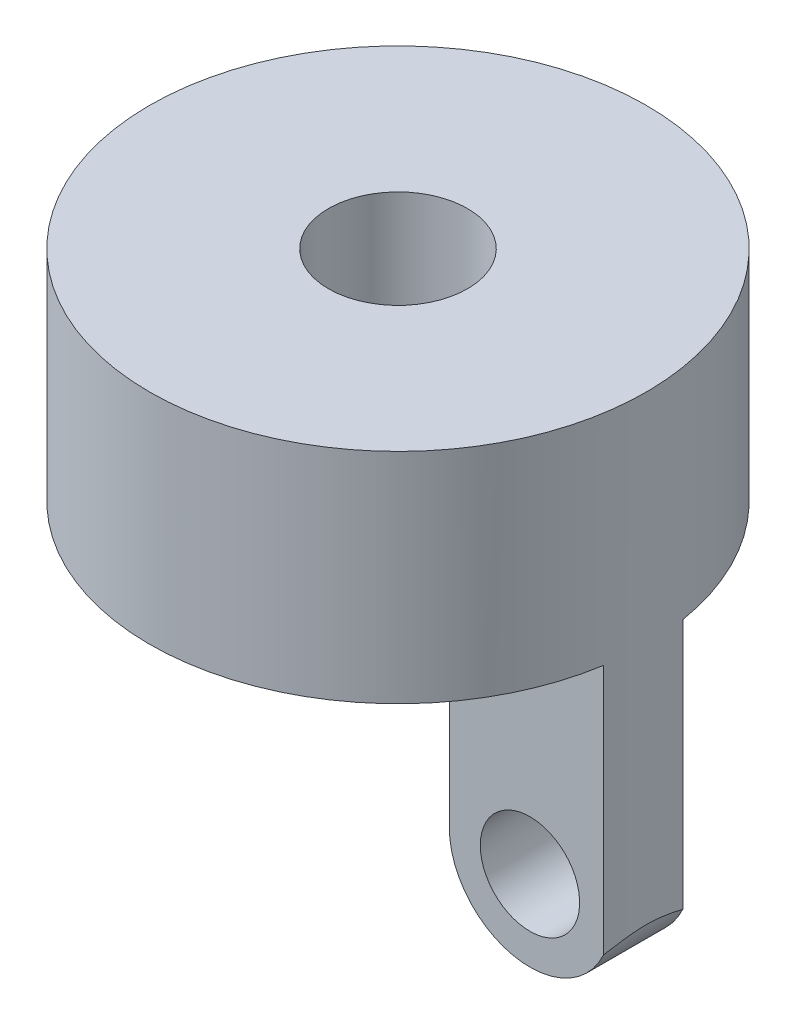
from build123d import *
from build123d.topology import SkipClean

# Parameters (mm, degrees)
SKETCH1_R                      = 12.5
SKETCH1_R_2                    = 3.5
BOSS_EXTRUDE1_DEPTH            = 5
BOSS_EXTRUDE2_START            = 6
SKETCH2_R                      = 12.5
SKETCH2_R_2                    = 5
BOSS_EXTRUDE2_DEPTH            = 6
SKETCH3_W                      = 10.120170627
SKETCH3_H                      = 4
BOSS_EXTRUDE3_DEPTH            = 15
SKETCH2_2_OUTSIDE_W            = 37.094
SKETCH2_2_OUTSIDE_H            = 35.914
SKETCH2_2_OUTSIDE_R            = 12.5
SKETCH2_2_OUTSIDE_R_2          = 5
CUT_EXTRUDE1_DEPTH             = 21
CUT_EXTRUDE2_REACH             = 29.45
SKETCH4_R                      = 2.5
CUT_EXTRUDE2_DIRECTION_2_REACH = 29.45


with BuildPart() as part:
    # Sketch1 → Boss-Extrude1 (new body)
    with BuildSketch(Plane(origin=(0, 0, 0), x_dir=(1, 0, 0), z_dir=(0, 1, 0))):
        with Locations(Location((0, 0, 0), (0, 0, 270))):
            Circle(SKETCH1_R)
        with Locations(Location((0, 0, 0), (0, 0, 270))):
            Circle(SKETCH1_R_2, mode=Mode.SUBTRACT)
    extrude(amount=BOSS_EXTRUDE1_DEPTH)

    # Sketch2 → Boss-Extrude2 (add)
    with BuildSketch(Plane.XZ.offset(BOSS_EXTRUDE2_START)):
        with Locations(Location((0, 0, 0), (0, 0, 270))):
            Circle(SKETCH2_R)
        with Locations(Location((0, 0, 0), (0, 0, 270))):
            Circle(SKETCH2_R_2, mode=Mode.SUBTRACT)
    extrude(amount=-BOSS_EXTRUDE2_DEPTH)

    # Sketch3 → Boss-Extrude3 (add)
    with BuildSketch(Plane.XZ.offset(6)):
        with Locations((8.62005684, 0)):
            Rectangle(SKETCH3_W, SKETCH3_H)
    extrude(amount=BOSS_EXTRUDE3_DEPTH)

    # Sketch2<2> outside → Cut-Extrude1 (cut)
    # profile 1 of 2: a face of its own
    with SkipClean():  # the faces are left unmerged after this step: merging them gives an invalid solid
        with BuildSketch(Plane.XZ):
            with Locations((0.59, 0)):
                Rectangle(SKETCH2_2_OUTSIDE_W, SKETCH2_2_OUTSIDE_H)
            with Locations(Location((0, 0, 0), (0, 0, 350.793103779))):
                Circle(SKETCH2_2_OUTSIDE_R, mode=Mode.SUBTRACT)
        # profile 2 of 2: a face of its own
        with BuildSketch(Plane.XZ):
            with Locations(Location((0, 0, 0), (0, 0, 23.578178478))):
                Circle(SKETCH2_2_OUTSIDE_R_2)
        extrude(amount=CUT_EXTRUDE1_DEPTH, mode=Mode.SUBTRACT)
    add(part.part.scale(1), mode=Mode.REPLACE)  # the faces are merged on a copy

    # Cut-Extrude2: up to this face of the body (flat: up to its plane)
    cut_extrude2_end = Plane(part.part.faces().sort_by_distance((8.460769187, -13.5, 2))[0])
    # Sketch4 → Cut-Extrude2 (cut, up to the picked face)
    with BuildSketch(Plane(origin=(0, 0, 0), x_dir=(-1, 0, 0), z_dir=(0, 0, -1)), mode=Mode.PRIVATE) as cut_extrude2_sk1:
        with Locations((-8.644378832, -16.938196863)):
            Circle(SKETCH4_R)
    cut_extrude2_tool1 = split(extrude(cut_extrude2_sk1.sketch, amount=-CUT_EXTRUDE2_REACH, mode=Mode.PRIVATE), bisect_by=cut_extrude2_end, keep=Keep.BOTH, mode=Mode.PRIVATE)
    # Sketch4 → Cut-Extrude2 (cut, up to the picked face)
    with BuildSketch(Plane(origin=(0, 0, 0), x_dir=(-1, 0, 0), z_dir=(0, 0, -1)), mode=Mode.PRIVATE) as cut_extrude2_sk2:
        with BuildLine():
            ThreePointArc((-8.644378832, -21), (-11.516507373, -19.810325405), (-12.706181968, -16.938196863))
            Line((-12.706181968, -16.938196863), (-12.706181968, -21))
            Line((-12.706181968, -21), (-8.644378832, -21))
        make_face()
    cut_extrude2_tool2 = split(extrude(cut_extrude2_sk2.sketch, amount=-CUT_EXTRUDE2_REACH, mode=Mode.PRIVATE), bisect_by=cut_extrude2_end, keep=Keep.BOTH, mode=Mode.PRIVATE)
    # Sketch4 → Cut-Extrude2 (cut, up to the picked face)
    with BuildSketch(Plane(origin=(0, 0, 0), x_dir=(-1, 0, 0), z_dir=(0, 0, -1)), mode=Mode.PRIVATE) as cut_extrude2_sk3:
        with BuildLine():
            Line((-4.582575695, -21), (-4.582575695, -16.938196863))
            ThreePointArc((-4.582575695, -16.938196863), (-5.77225029, -19.810325405), (-8.644378832, -21))
            Line((-8.644378832, -21), (-4.582575695, -21))
        make_face()
    cut_extrude2_tool3 = split(extrude(cut_extrude2_sk3.sketch, amount=-CUT_EXTRUDE2_REACH, mode=Mode.PRIVATE), bisect_by=cut_extrude2_end, keep=Keep.BOTH, mode=Mode.PRIVATE)
    add(cut_extrude2_tool1.solids().sort_by(Axis((8.644379, -16.938197, 0), (0, 0, 1)))[0], mode=Mode.SUBTRACT)
    add(cut_extrude2_tool2.solids().sort_by(Axis((11.798905, -20.092723, 0), (0, 0, 1)))[0], mode=Mode.SUBTRACT)
    add(cut_extrude2_tool3.solids().sort_by(Axis((5.489852, -20.092723, 0), (0, 0, 1)))[0], mode=Mode.SUBTRACT)

    # Cut-Extrude2 direction 2: up to this face of the body (flat: up to its plane)
    cut_extrude2_direction_2_end = Plane(part.part.faces().sort_by_distance((8.460769187, -13.5, -2))[0])
    # Sketch4 → Cut-Extrude2 direction 2 (cut, up to the picked face)
    with BuildSketch(Plane(origin=(0, 0, 0), x_dir=(-1, 0, 0), z_dir=(0, 0, -1)), mode=Mode.PRIVATE) as cut_extrude2_direction_2_sk1:
        with Locations((-8.644378832, -16.938196863)):
            Circle(SKETCH4_R)
    cut_extrude2_direction_2_tool1 = split(extrude(cut_extrude2_direction_2_sk1.sketch, amount=CUT_EXTRUDE2_DIRECTION_2_REACH, mode=Mode.PRIVATE), bisect_by=cut_extrude2_direction_2_end, keep=Keep.BOTH, mode=Mode.PRIVATE)
    # Sketch4 → Cut-Extrude2 direction 2 (cut, up to the picked face)
    with BuildSketch(Plane(origin=(0, 0, 0), x_dir=(-1, 0, 0), z_dir=(0, 0, -1)), mode=Mode.PRIVATE) as cut_extrude2_direction_2_sk2:
        with BuildLine():
            ThreePointArc((-8.644378832, -21), (-11.516507373, -19.810325405), (-12.706181968, -16.938196863))
            Line((-12.706181968, -16.938196863), (-12.706181968, -21))
            Line((-12.706181968, -21), (-8.644378832, -21))
        make_face()
    cut_extrude2_direction_2_tool2 = split(extrude(cut_extrude2_direction_2_sk2.sketch, amount=CUT_EXTRUDE2_DIRECTION_2_REACH, mode=Mode.PRIVATE), bisect_by=cut_extrude2_direction_2_end, keep=Keep.BOTH, mode=Mode.PRIVATE)
    # Sketch4 → Cut-Extrude2 direction 2 (cut, up to the picked face)
    with BuildSketch(Plane(origin=(0, 0, 0), x_dir=(-1, 0, 0), z_dir=(0, 0, -1)), mode=Mode.PRIVATE) as cut_extrude2_direction_2_sk3:
        with BuildLine():
            Line((-4.582575695, -21), (-4.582575695, -16.938196863))
            ThreePointArc((-4.582575695, -16.938196863), (-5.77225029, -19.810325405), (-8.644378832, -21))
            Line((-8.644378832, -21), (-4.582575695, -21))
        make_face()
    cut_extrude2_direction_2_tool3 = split(extrude(cut_extrude2_direction_2_sk3.sketch, amount=CUT_EXTRUDE2_DIRECTION_2_REACH, mode=Mode.PRIVATE), bisect_by=cut_extrude2_direction_2_end, keep=Keep.BOTH, mode=Mode.PRIVATE)
    add(cut_extrude2_direction_2_tool1.solids().sort_by(Axis((8.644379, -16.938197, 0), (0, 0, -1)))[0], mode=Mode.SUBTRACT)
    add(cut_extrude2_direction_2_tool2.solids().sort_by(Axis((11.798905, -20.092723, 0), (0, 0, -1)))[0], mode=Mode.SUBTRACT)
    add(cut_extrude2_direction_2_tool3.solids().sort_by(Axis((5.489852, -20.092723, 0), (0, 0, -1)))[0], mode=Mode.SUBTRACT)


solid = part.part
